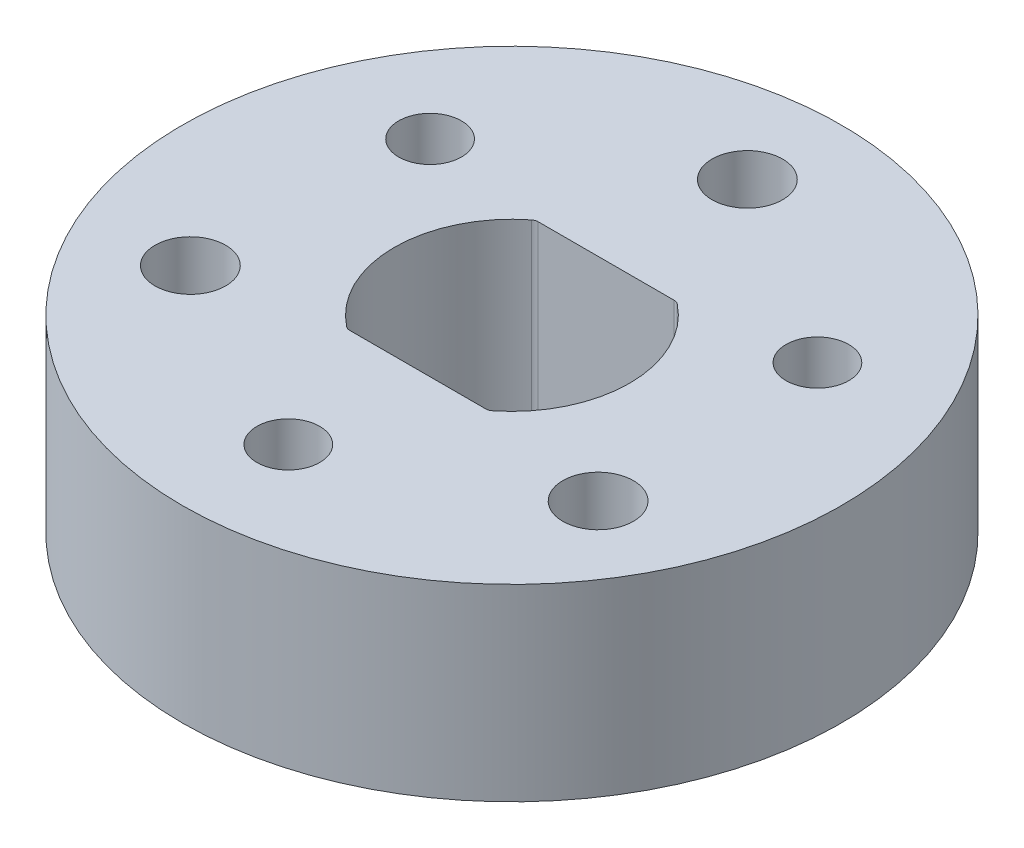
from build123d import *

# Parameters (mm, degrees)
SKETCH1_R               = 21
SKETCH1_R_2             = 1
BOSS_EXTRUDE1_DEPTH     = 12
CUT_EXTRUDE1_DEPTH      = 33.031234756
CUT_EXTRUDE1_DEPTH_BACK = 33.031234756
FILLET2_R               = 0.5
M4_CLEARANCE_HOLE1_D    = 4.5
F_4_0MM_DOWEL_HOLE1_D   = 4


with BuildPart() as part:
    # Sketch1 → Boss-Extrude1 (new body)
    with BuildSketch(Plane(origin=(0, 0, 0), x_dir=(1, 0, 0), z_dir=(0, 1, 0))):
        Circle(SKETCH1_R)
        with Locations((0, 15)):
            Circle(SKETCH1_R_2, mode=Mode.SUBTRACT)
        with Locations((-12.340862004, 7.125)):
            Circle(SKETCH1_R_2, mode=Mode.SUBTRACT)
        with Locations((12.990381057, -7.5)):
            Circle(SKETCH1_R_2, mode=Mode.SUBTRACT)
        with Locations((-12.990381057, -7.5)):
            Circle(SKETCH1_R_2, mode=Mode.SUBTRACT)
        with Locations((12.340862004, 7.125)):
            Circle(SKETCH1_R_2, mode=Mode.SUBTRACT)
        with Locations((0, -14.25)):
            Circle(SKETCH1_R_2, mode=Mode.SUBTRACT)
    extrude(amount=BOSS_EXTRUDE1_DEPTH)

    # Sketch2 → Cut-Extrude1 (cut, two sides: drawn at the far end of the back side and taken through both)
    with BuildSketch(Plane(origin=(0, 12, 0), x_dir=(1, 0, 0), z_dir=(0, 1, 0)).offset(-CUT_EXTRUDE1_DEPTH_BACK)):
        with BuildLine():
            Line((-4.5, -6), (4.5, -6))
            ThreePointArc((4.5, -6), (7.5, 0), (4.5, 6))
            Line((4.5, 6), (-4.5, 6))
            ThreePointArc((-4.5, 6), (-7.5, 0), (-4.5, -6))
        make_face()
    extrude(amount=CUT_EXTRUDE1_DEPTH + CUT_EXTRUDE1_DEPTH_BACK, mode=Mode.SUBTRACT)

    # Fillet2
    fillet2_edges = [part.edges().sort_by_distance(p)[0] for p in [
        (4.5, 6, 6),
        (-4.5, 6, 6),
        (-4.5, 6, -6),
        (4.5, 6, -6),
    ]]
    fillet(fillet2_edges, radius=FILLET2_R)

    # M4 Clearance Hole1 (through all)
    with Locations(Plane(origin=(0, 12, 0), x_dir=(1, 0, 0), z_dir=(0, 1, 0))):
        with Locations((0, 15), (12.990381057, -7.5), (-12.990381057, -7.5)):
            Hole(M4_CLEARANCE_HOLE1_D / 2)

    # Ø4.0mm Dowel Hole1 (through all)
    with Locations(Plane(origin=(0, 12, 0), x_dir=(1, 0, 0), z_dir=(0, 1, 0))):
        with Locations((-12.340862004, 7.125), (12.340862004, 7.125), (0, -14.25)):
            Hole(F_4_0MM_DOWEL_HOLE1_D / 2)


solid = part.part
